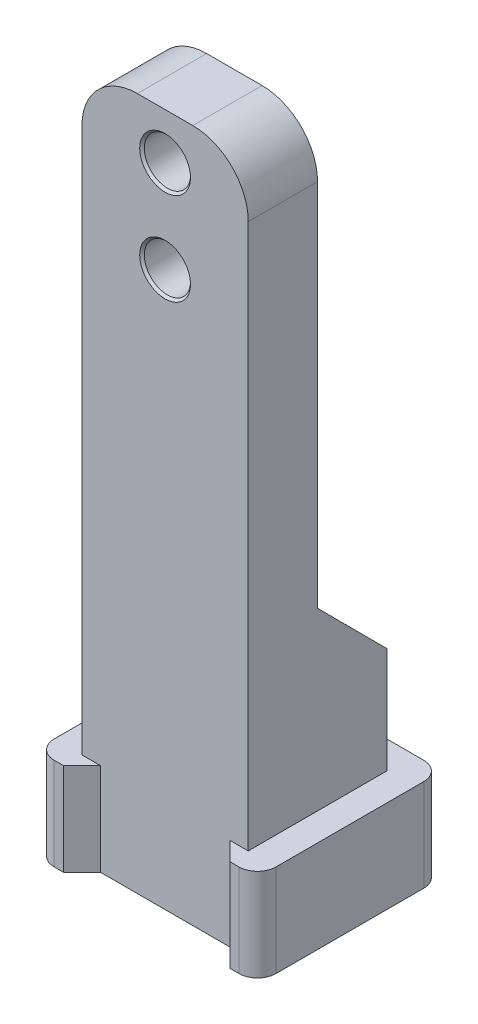
from build123d import *

# Parameters (mm, degrees)
SKETCH1_W           = 18
SKETCH1_H           = 15
BOSS_EXTRUDE1_DEPTH = 75
SKETCH2_R           = 2.5
CUT_EXTRUDE1_DEPTH  = 12
CUT_EXTRUDE2_DEPTH  = 48
SKETCH4_R           = 2.5
CUT_EXTRUDE3_DEPTH  = 48
FILLET1_R           = 6
BOSS_EXTRUDE2_DEPTH = 10
CHAMFER3_SIZE       = 2
FILLET2_R           = 2
CHAMFER4_SIZE       = 0.25


with BuildPart() as part:
    # Sketch1 → Boss-Extrude1 (new body)
    with BuildSketch(Plane(origin=(0, 0, 0), x_dir=(1, 0, 0), z_dir=(0, 1, 0))):
        with Locations((9, 7.5)):
            Rectangle(SKETCH1_W, SKETCH1_H)
    extrude(amount=BOSS_EXTRUDE1_DEPTH)

    # Sketch2 → Cut-Extrude1 (cut)
    with BuildSketch(Plane.XZ):
        with Locations(Location((14, -6, 0), (0, 0, 270))):
            Circle(SKETCH2_R)
        with Locations(Location((4, -6, 0), (0, 0, 270))):
            Circle(SKETCH2_R)
    extrude(amount=-CUT_EXTRUDE1_DEPTH, mode=Mode.SUBTRACT)

    # Sketch3 → Cut-Extrude2 (cut)
    with BuildSketch(Plane(origin=(18, 0, 0), x_dir=(0, 0, -1), z_dir=(1, 0, 0))):
        Polygon((7.5, 75), (7.5, 29), (15, 21.472065282), (15, 75), align=None)
    extrude(amount=-CUT_EXTRUDE2_DEPTH, mode=Mode.SUBTRACT)

    # Sketch4 → Cut-Extrude3 (cut)
    with BuildSketch(Plane.XY):
        with Locations((9, 70)):
            Circle(SKETCH4_R)
        with Locations((9, 60)):
            Circle(SKETCH4_R)
    extrude(amount=-CUT_EXTRUDE3_DEPTH, mode=Mode.SUBTRACT)

    # Fillet1
    fillet1_edges = [part.edges().sort_by_distance(p)[0] for p in [
        (18, 75, -3.75),
        (0, 75, -3.75),
    ]]
    fillet(fillet1_edges, radius=FILLET1_R)

    # Sketch5 → Boss-Extrude2 (add)
    with BuildSketch(Plane.XZ):
        Polygon((0, 0), (0, 2), (-3, 2), (-3, -18), (21, -18), (21, 2), (18, 2), (18, 0), (18, -15), (0, -15), align=None)
    extrude(amount=-BOSS_EXTRUDE2_DEPTH)

    # Chamfer3
    chamfer3_edges = [part.edges().sort_by_distance(p)[0] for p in [
        (0, 5, 0),
        (18, 5, 0),
    ]]
    chamfer(chamfer3_edges, length=CHAMFER3_SIZE - 0.0001)  # a hair under: the kernel refuses the full size

    # Fillet2
    fillet2_edges = [part.edges().sort_by_distance(p)[0] for p in [
        (21, 5, 2),
        (21, 5, -18),
        (-3, 5, -18),
        (-3, 5, 2),
    ]]
    fillet(fillet2_edges, radius=FILLET2_R)

    # Chamfer4
    chamfer4_edges = [part.edges().sort_by_distance(p)[0] for p in [
        (4, 0, -3.5),
        (14, 0, -3.5),
        (6.5, 70, 0),
        (6.5, 60, 0),
    ]]
    chamfer(chamfer4_edges, length=CHAMFER4_SIZE)


solid = part.part
